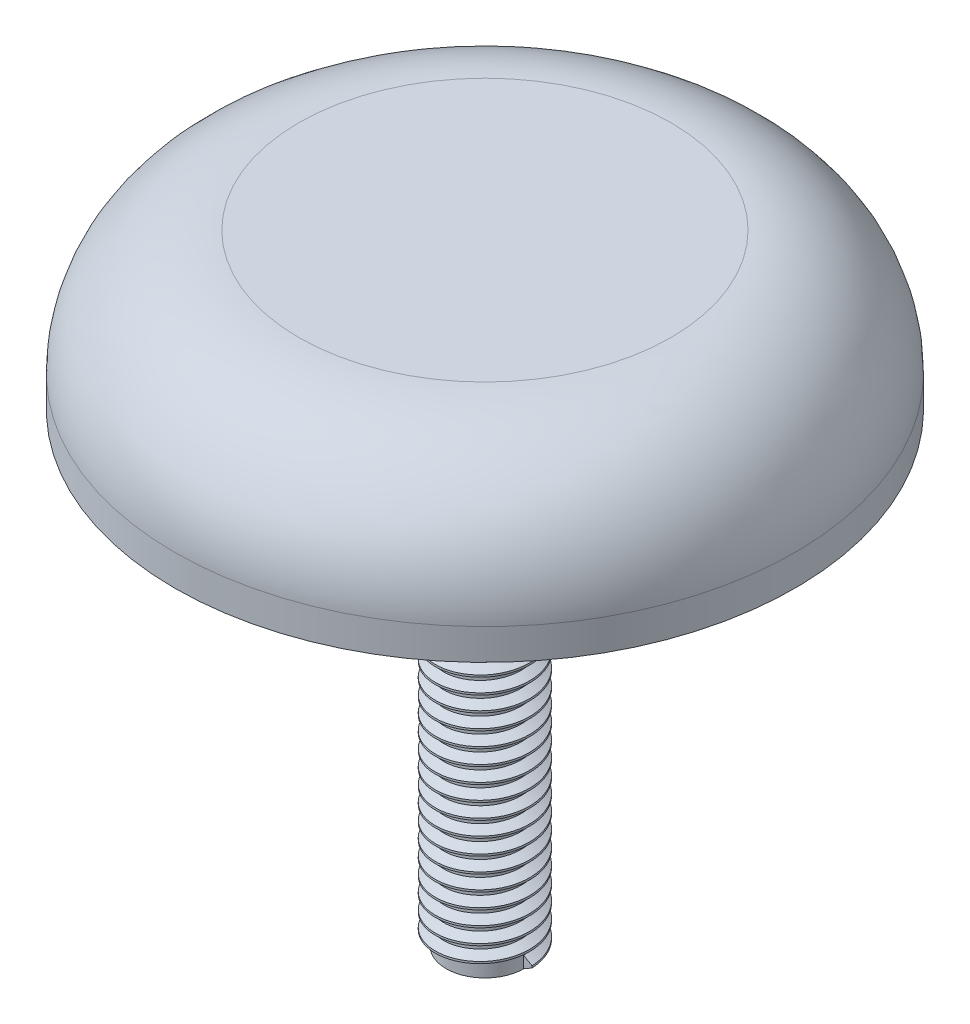
from build123d import *
from build123d.topology import SkipClean

# Parameters (mm, degrees)
SKETCH_1_R      = 2.5
EXTRUDE_1_DEPTH = 30
SKETCH_2_R      = 20
EXTRUDE_2_DEPTH = 10
FILLET_1_R      = 8
THREAD_1_PITCH  = 1


with BuildPart() as part:
    # Эскиз1 → Бобышка-Вытянуть1 (new body)
    with BuildSketch(Plane(origin=(0, 0, 0), x_dir=(1, 0, 0), z_dir=(0, 1, 0))):
        with Locations(Location((0, 0, 0), (0, 0, 270))):
            Circle(SKETCH_1_R)
    extrude(amount=EXTRUDE_1_DEPTH)

    # Sketch 2 → Бобышка-Вытянуть2 (add)
    with BuildSketch(Plane(origin=(0, 30, 0), x_dir=(1, 0, 0), z_dir=(0, 1, 0))):
        with Locations(Location((0, 0, 0), (0, 0, 270))):
            Circle(SKETCH_2_R)
    extrude(amount=EXTRUDE_2_DEPTH)

    # Скругление1
    fillet_1_edges = [part.edges().sort_by_distance(p)[0] for p in [
        (0, 40, -20),
    ]]
    fillet(fillet_1_edges, radius=FILLET_1_R)

    # Резьба1: the profile of Sketch 2 2 profile screwed along a right-hand helix of 30 turns, 8 arcs to a turn; built about Z, then put on its axis
    with SkipClean():  # the faces are left unmerged after this step: merging them gives an invalid solid
        thread_1_z = Axis((0, 0, 0), (0, 0, 1))
        thread_1_corners = [(2.4997, 0, -0.000173205), (3.041265875, 0, 0.312499999), (3.041265875, 0, 0.437499999), (2.4997, 0, 0.750173202)]
        with BuildLine(mode=Mode.PRIVATE) as thread_1_profile:
            Line(thread_1_corners[0], thread_1_corners[1])
            Line(thread_1_corners[1], thread_1_corners[2])
            Line(thread_1_corners[2], thread_1_corners[3])
            Line(thread_1_corners[3], thread_1_corners[0])
        thread_1_cap = Face(thread_1_profile.wire())
        thread_1_turn_angles = [0, 22.5, 45, 67.5, 90, 112.5, 135, 157.5, 180, 202.5, 225, 247.5, 270, 292.5, 315, 337.5, 360]
        thread_1_turn_weights = [1, 0.9238795325112867, 1, 0.9238795325112867, 1, 0.9238795325112867, 1, 0.9238795325112867, 1, 0.9238795325112867, 1, 0.9238795325112867, 1, 0.9238795325112867, 1, 0.9238795325112867, 1]
        thread_1_turn_rails = [Edge.make_bspline([Vector(p[0], p[1], 0).rotate(thread_1_z, thread_1_turn_angles[k]) / thread_1_turn_weights[k] + Vector(0, 0, p[2] + THREAD_1_PITCH * thread_1_turn_angles[k] / 360) for k in range(17)], [0, 0, 0, 1, 1, 2, 2, 3, 3, 4, 4, 5, 5, 6, 6, 7, 7, 8, 8, 8], 2, thread_1_turn_weights) for p in thread_1_corners]
        thread_1_turn_sides = [Face.make_surface_from_curves(thread_1_turn_rails[p[0]], thread_1_turn_rails[p[1]]) for p in [(0, 1), (1, 2), (2, 3), (3, 0)]]
        thread_1 = Plane(origin=(0, 0, 0), x_dir=(1, 0, 0), z_dir=(0, 1, 0)) * Solid(Shell([*[p.moved(Location((0, 0, THREAD_1_PITCH * i))) for i in range(30) for p in thread_1_turn_sides], thread_1_cap, thread_1_cap.rotate(thread_1_z, 10800).moved(Location((0, 0, THREAD_1_PITCH * 10800 / 360)))]))
        add(thread_1)


solid = part.part
